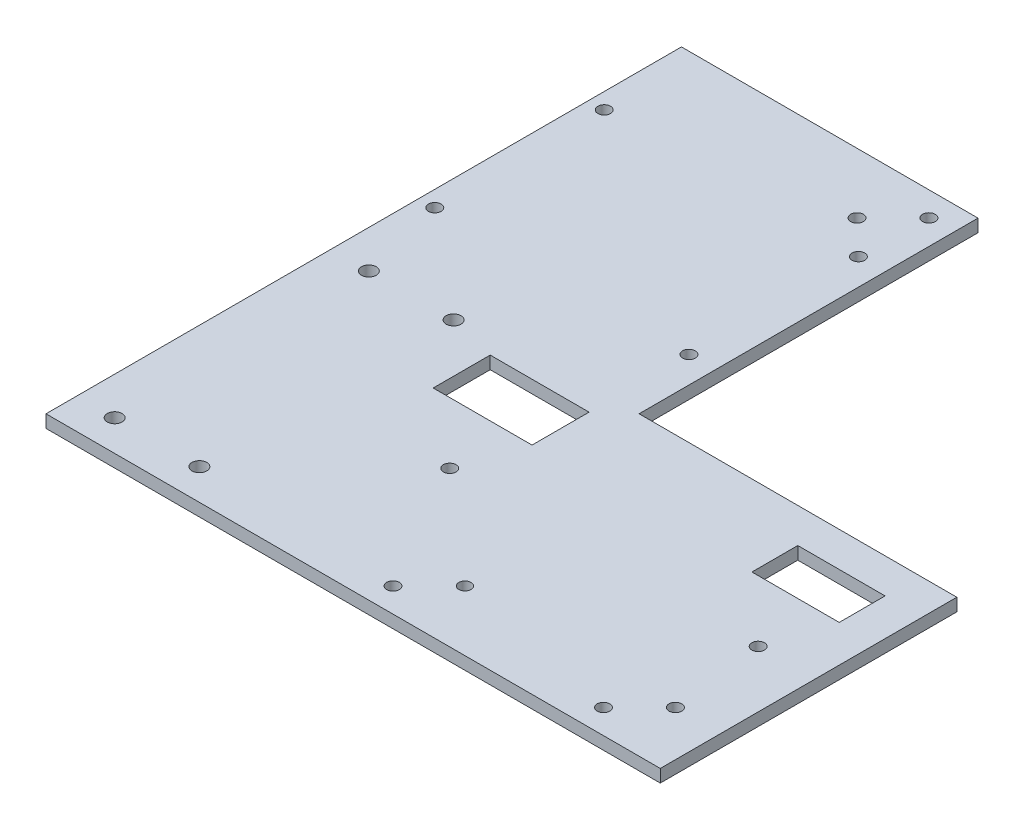
from build123d import *

# Parameters (mm, degrees)
SKETCH1_R           = 1.5
SKETCH1_R_2         = 1.44463942
SKETCH1_R_3         = 1.75
SKETCH1_W           = 23.332723566
SKETCH1_H           = 13.458477976
SKETCH1_W_2         = 20.606585233
SKETCH1_H_2         = 10.826007204
BOSS_EXTRUDE1_DEPTH = 3


with BuildPart() as part:
    # Sketch1 → Boss-Extrude1 (new body)
    with BuildSketch(Plane(origin=(0, 0, 0), x_dir=(1, 0, 0), z_dir=(0, 1, 0))):
        Polygon((-72.5, -35), (72.5, -35), (72.5, 35), (-2.5, 35), (-2.5, 115), (-72.5, 115), (-72.5, 35), align=None)
        with Locations((3.654827994, -29.242640687)):
            Circle(SKETCH1_R, mode=Mode.SUBTRACT)
        with Locations((12.140109368, -20.757359313)):
            Circle(SKETCH1_R_2, mode=Mode.SUBTRACT)
        with Locations((53.338095075, -29.242640687)):
            Circle(SKETCH1_R, mode=Mode.SUBTRACT)
        with Locations((61.823376449, -20.757359313)):
            Circle(SKETCH1_R, mode=Mode.SUBTRACT)
        with Locations((-16.814355015, 100.757359313)):
            Circle(SKETCH1_R, mode=Mode.SUBTRACT)
        with Locations((-8.329073641, 109.242640687)):
            Circle(SKETCH1_R, mode=Mode.SUBTRACT)
        with Locations((-13.69982199, 1.5)):
            Circle(SKETCH1_R, mode=Mode.SUBTRACT)
        with Locations((59.109237961, 1.5)):
            Circle(SKETCH1_R, mode=Mode.SUBTRACT)
        with Locations((-63.584566194, -27.710636817)):
            Circle(SKETCH1_R_3, mode=Mode.SUBTRACT)
        with Locations((-43.584566194, -27.710636817)):
            Circle(SKETCH1_R_3, mode=Mode.SUBTRACT)
        with Locations((-43.584566194, 32.289363183)):
            Circle(SKETCH1_R_3, mode=Mode.SUBTRACT)
        with Locations((-63.584566194, 32.289363183)):
            Circle(SKETCH1_R_3, mode=Mode.SUBTRACT)
        with Locations((-68.740395312, 53.009730632)):
            Circle(SKETCH1_R, mode=Mode.SUBTRACT)
        with Locations((-68.740395312, 93.009730632)):
            Circle(SKETCH1_R, mode=Mode.SUBTRACT)
        with Locations((-8.740395312, 93.009730632)):
            Circle(SKETCH1_R, mode=Mode.SUBTRACT)
        with Locations((-8.740395312, 53.009730632)):
            Circle(SKETCH1_R, mode=Mode.SUBTRACT)
        with Locations((-20.406757095, 22.7)):
            Rectangle(SKETCH1_W, SKETCH1_H, mode=Mode.SUBTRACT)
        with Locations((53.46751152, 21.383764614)):
            Rectangle(SKETCH1_W_2, SKETCH1_H_2, mode=Mode.SUBTRACT)
    extrude(amount=BOSS_EXTRUDE1_DEPTH)


solid = part.part
